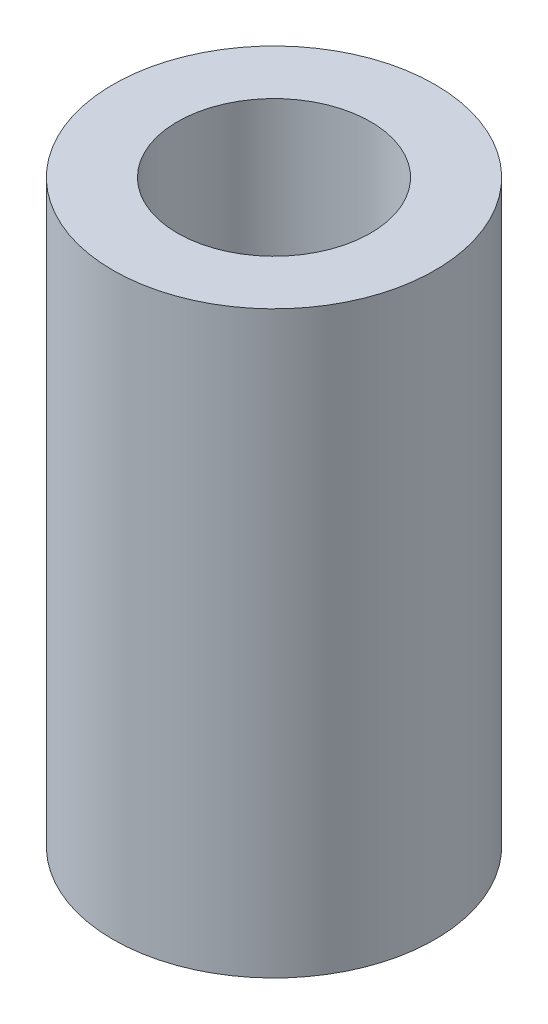
from build123d import *

# Parameters (mm, degrees)
SKETCH1_R           = 2.5
SKETCH1_R_2         = 1.5
BOSS_EXTRUDE1_DEPTH = 9


with BuildPart() as part:
    # Sketch1 → Boss-Extrude1 (new body)
    with BuildSketch(Plane(origin=(0, 0, 0), x_dir=(1, 0, 0), z_dir=(0, 1, 0))):
        Circle(SKETCH1_R)
        Circle(SKETCH1_R_2, mode=Mode.SUBTRACT)
    extrude(amount=BOSS_EXTRUDE1_DEPTH)


solid = part.part
